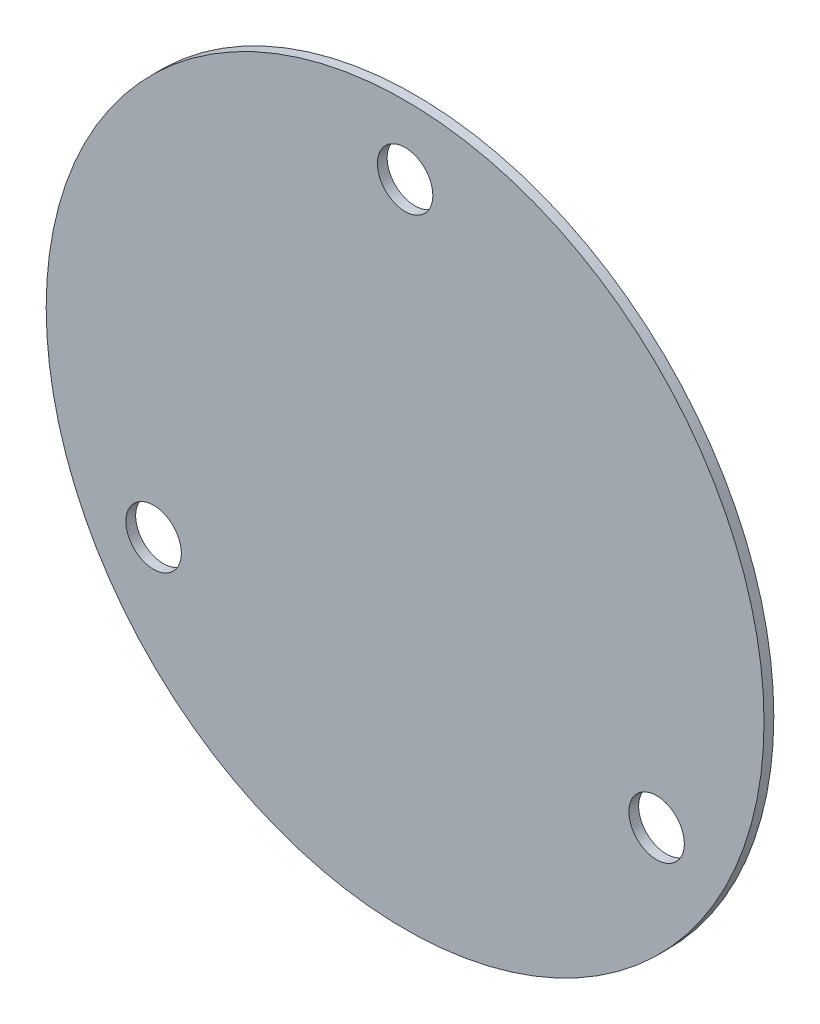
from build123d import *

# Parameters (mm, degrees)
SKETCH_1_R             = 110
SKETCH_1_R_2           = 8.5
SM_BASE_FLANGE_1_DEPTH = 3


# Sheet-metal steps are written as plain solids
with BuildPart() as part:
    # Sketch 1 → Базовая кромка1 (new body)
    with BuildSketch(Plane.XY):
        Circle(SKETCH_1_R)
        with Locations((0, 89)):
            Circle(SKETCH_1_R_2, mode=Mode.SUBTRACT)
        with Locations((77.076260937, -44.5)):
            Circle(SKETCH_1_R_2, mode=Mode.SUBTRACT)
        with Locations((-77.076260937, -44.5)):
            Circle(SKETCH_1_R_2, mode=Mode.SUBTRACT)
    extrude(amount=-SM_BASE_FLANGE_1_DEPTH)


solid = part.part
